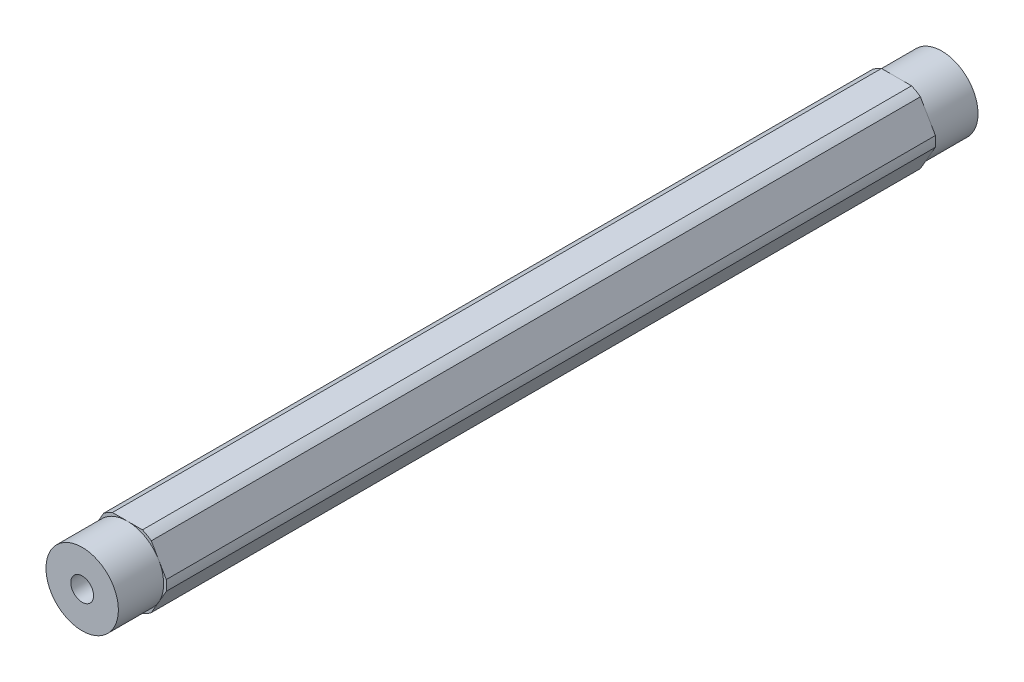
from build123d import *

# Parameters (mm, degrees)
SKETCH1_R           = 2.000000064
BOSS_EXTRUDE1_DEPTH = 67.44335
SKETCH4_R           = 6.35
SKETCH4_R_2         = 2.000000064
BOSS_EXTRUDE2_DEPTH = 7.9375


with BuildPart() as part:
    # Sketch1 → Boss-Extrude1 (new, symmetric)
    with BuildSketch(Plane.XY):
        with BuildLine():
            ThreePointArc((4.181770846, 5.456960429), (3.437499983, 5.953924622), (2.634980936, 6.35))
            Line((2.634980936, 6.35), (-2.634980936, 6.35))
            ThreePointArc((-2.634980936, 6.35), (-3.437499983, 5.953924622), (-4.181770846, 5.456960429))
            Line((-4.181770846, 5.456960429), (-6.816751782, 0.893039571))
            ThreePointArc((-6.816751782, 0.893039571), (-6.874999966, 0), (-6.816751782, -0.893039571))
            Line((-6.816751782, -0.893039571), (-4.181770846, -5.456960429))
            ThreePointArc((-4.181770846, -5.456960429), (-3.437499983, -5.953924622), (-2.634980936, -6.35))
            Line((-2.634980936, -6.35), (2.634980936, -6.35))
            ThreePointArc((2.634980936, -6.35), (3.437499983, -5.953924622), (4.181770846, -5.456960429))
            Line((4.181770846, -5.456960429), (6.816751782, -0.893039571))
            ThreePointArc((6.816751782, -0.893039571), (6.860422465, -0.447468582), (6.874999966, 0))
            ThreePointArc((6.874999966, 0), (6.860422465, 0.447468582), (6.816751782, 0.893039571))
            Line((6.816751782, 0.893039571), (4.181770846, 5.456960429))
        make_face()
        Circle(SKETCH1_R, mode=Mode.SUBTRACT)
    extrude(amount=BOSS_EXTRUDE1_DEPTH, both=True)

    # Sketch4 → Boss-Extrude2 (add)
    with BuildSketch(Plane.XY.offset(67.44335)):
        Circle(SKETCH4_R)
        Circle(SKETCH4_R_2, mode=Mode.SUBTRACT)
    boss_extrude2 = extrude(amount=BOSS_EXTRUDE2_DEPTH)

    # Mirror1: Boss-Extrude2 across plane
    add(boss_extrude2.mirror(Plane.XY))


solid = part.part
